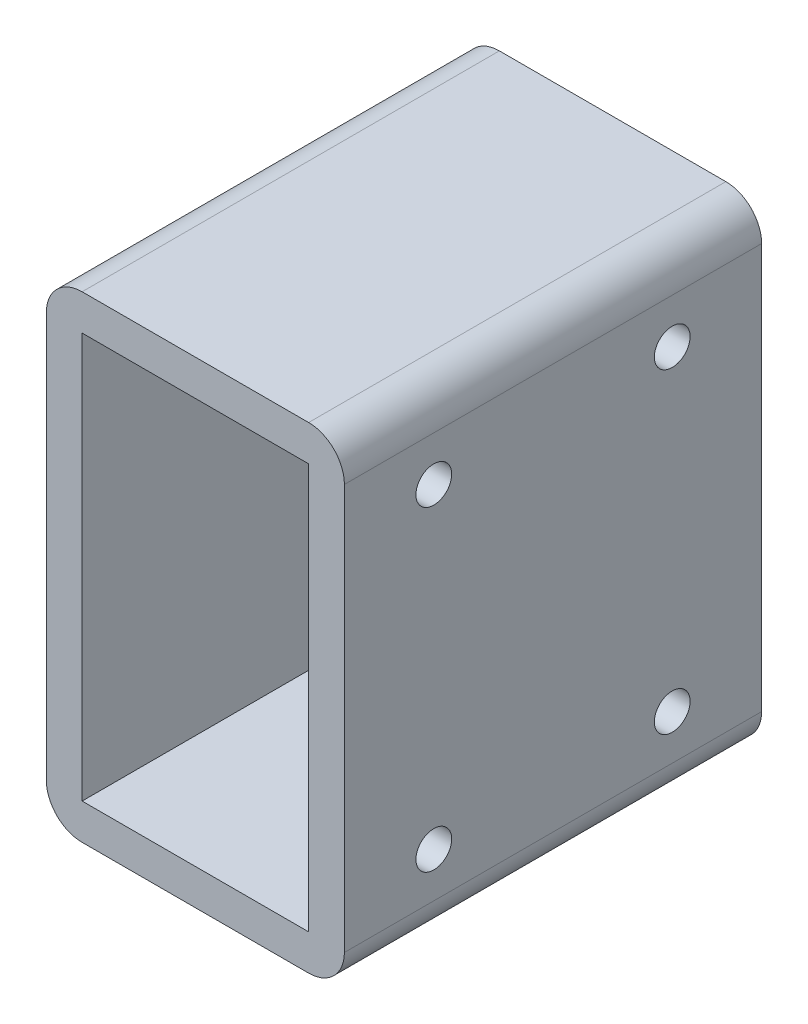
from build123d import *

# Parameters (mm, degrees)
SKETCH1_W           = 38
SKETCH1_H           = 68
BOSS_EXTRUDE1_DEPTH = 35
SKETCH2_R           = 3
CUT_EXTRUDE1_DEPTH  = 10


with BuildPart() as part:
    # Sketch1 → Boss-Extrude1 (new, symmetric)
    with BuildSketch(Plane.XY):
        with BuildLine():
            Line((19, -40), (-19, -40))
            ThreePointArc((-19, -40), (-23.242640687, -38.242640687), (-25, -34))
            Line((-25, -34), (-25, 34))
            ThreePointArc((-25, 34), (-23.242640687, 38.242640687), (-19, 40))
            Line((-19, 40), (19, 40))
            ThreePointArc((19, 40), (23.242640687, 38.242640687), (25, 34))
            Line((25, 34), (25, -34))
            ThreePointArc((25, -34), (23.242640687, -38.242640687), (19, -40))
        make_face()
        Rectangle(SKETCH1_W, SKETCH1_H, mode=Mode.SUBTRACT)
    extrude(amount=BOSS_EXTRUDE1_DEPTH, both=True)

    # Sketch2 → Cut-Extrude1 (cut)
    with BuildSketch(Plane(origin=(25, 0, 0), x_dir=(0, 0, -1), z_dir=(1, 0, 0))):
        with Locations((-20, 26.5)):
            Circle(SKETCH2_R)
        with Locations((20, 26.5)):
            Circle(SKETCH2_R)
        with Locations((20, -26.5)):
            Circle(SKETCH2_R)
        with Locations((-20, -26.5)):
            Circle(SKETCH2_R)
    extrude(amount=-CUT_EXTRUDE1_DEPTH, mode=Mode.SUBTRACT)


solid = part.part
